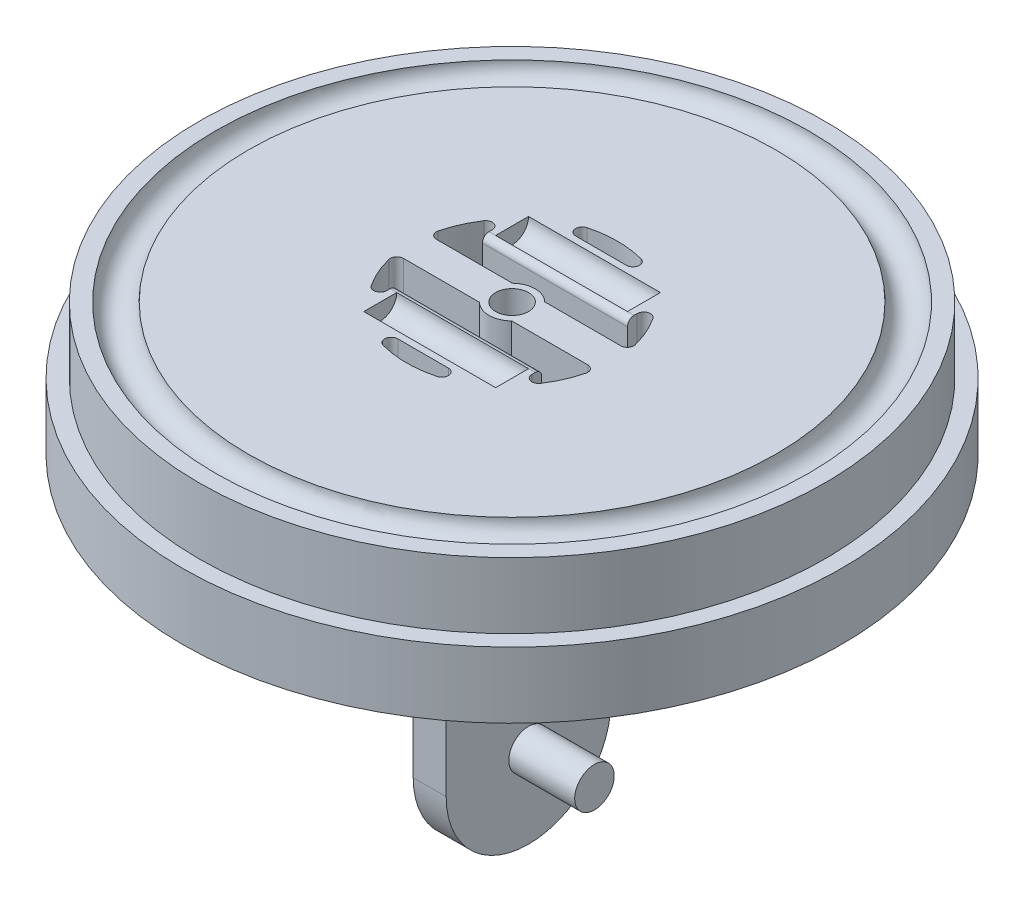
from build123d import *

# Parameters (mm, degrees)
SKETCH1_R           = 50
BOSS_EXTRUDE1_DEPTH = 10
SKETCH3_R           = 47.5
BOSS_EXTRUDE2_DEPTH = 10
SKETCH5_R           = 2.5
SKETCH6_R           = 2.5
CUT_EXTRUDE1_DEPTH  = 5
CUT_EXTRUDE2_START  = -0.01
SKETCH7_R           = 47.5
CUT_EXTRUDE2_DEPTH  = 0.01
SKETCH10_R          = 2.5
CUT_EXTRUDE4_DEPTH  = 10
CUT_EXTRUDE7_DEPTH  = 74.481971258
FILLET1_R           = 1
FILLET2_R           = 1
BOSS_EXTRUDE3_DEPTH = 2.5
FILLET3_R           = 1
FILLET4_START       = -12
FILLET4_DEPTH       = 24
FILLET5_R           = 1
SKETCH14_R          = 3
BOSS_EXTRUDE5_DEPTH = 10


with BuildPart() as part:
    # Sketch1 → Boss-Extrude1 (new body)
    with BuildSketch(Plane(origin=(0, 0, 0), x_dir=(1, 0, 0), z_dir=(0, 1, 0))):
        with Locations(Location((0, 0, 0), (0, 0, 270))):
            Circle(SKETCH1_R)
    extrude(amount=BOSS_EXTRUDE1_DEPTH)

    # Sketch3 → Boss-Extrude2 (add)
    with BuildSketch(Plane(origin=(0, 10, 0), x_dir=(1, 0, 0), z_dir=(0, 1, 0))):
        with Locations(Location((0, 0, 0), (0, 0, 270))):
            Circle(SKETCH3_R)
    extrude(amount=BOSS_EXTRUDE2_DEPTH)

    # Cut-Sweep1: sweep along a path in Sketch4
    with BuildLine(Plane(origin=(0, 20, 0), x_dir=(1, 0, 0), z_dir=(0, 1, 0))) as cut_sweep1_path:
        CenterArc((0, 0), 42.5, 0, 360)
    # Sketch5 → Cut-Sweep1 (sweep, cut)
    with BuildSketch(Plane.XY):
        with Locations((42.5, 20)):
            Circle(SKETCH5_R)
    sweep(path=cut_sweep1_path.line, mode=Mode.SUBTRACT)

    # Sketch6 → Cut-Extrude1 (cut)
    with BuildSketch(Plane(origin=(0, 20, 0), x_dir=(1, 0, 0), z_dir=(0, 1, 0))):
        with Locations(Location((0, 0, 0), (0, 0, 270))):
            Circle(SKETCH6_R)
    extrude(amount=-CUT_EXTRUDE1_DEPTH, mode=Mode.SUBTRACT)

    # Sketch7 → Cut-Extrude2 (cut)
    with BuildSketch(Plane(origin=(0, 20, 0), x_dir=(1, 0, 0), z_dir=(0, 1, 0)).offset(CUT_EXTRUDE2_START)):
        with Locations(Location((0, 0, 0), (0, 0, 270))):
            Circle(SKETCH7_R)
    extrude(amount=CUT_EXTRUDE2_DEPTH, mode=Mode.SUBTRACT)

    # Sketch10 → Cut-Extrude4 (cut, symmetric)
    with BuildSketch(Plane(origin=(0, 0, 0), x_dir=(0, 0, -1), z_dir=(1, 0, 0))):
        with Locations((-10, 19.99)):
            Circle(SKETCH10_R)
        with Locations((10, 19.99)):
            Circle(SKETCH10_R)
    extrude(amount=CUT_EXTRUDE4_DEPTH, both=True, mode=Mode.SUBTRACT)

    # Sketch11 → Cut-Extrude7 (cut, through all)
    with BuildSketch(Plane(origin=(0, 19.99, 0), x_dir=(1, 0, 0), z_dir=(0, 1, 0))):
        with BuildLine():
            ThreePointArc((-2.449489743, 2.5), (0, 3.5), (2.449489743, 2.5))
            Line((2.449489743, 2.5), (15.209986881, 2.5))
            ThreePointArc((15.209986881, 2.5), (13.746070636, 6.974184039), (11, 10.797856312))
            Line((11, 10.797856312), (11, 6.5))
            Line((11, 6.5), (-11, 6.5))
            Line((-11, 6.5), (-11, 10.797856312))
            ThreePointArc((-11, 10.797856312), (-13.746070636, 6.974184039), (-15.209986881, 2.5))
            Line((-15.209986881, 2.5), (-2.449489743, 2.5))
        make_face()
        with BuildLine():
            ThreePointArc((11, -10.797856312), (13.746070636, -6.974184039), (15.209986881, -2.5))
            Line((15.209986881, -2.5), (2.449489743, -2.5))
            ThreePointArc((2.449489743, -2.5), (0, -3.5), (-2.449489743, -2.5))
            Line((-2.449489743, -2.5), (-15.209986881, -2.5))
            ThreePointArc((-15.209986881, -2.5), (-13.746070636, -6.974184039), (-11, -10.797856312))
            Line((-11, -10.797856312), (-11, -6.5))
            Line((-11, -6.5), (11, -6.5))
            Line((11, -6.5), (11, -10.797856312))
        make_face()
        with BuildLine():
            ThreePointArc((-8.587782019, -13.5), (0, -16), (8.587782019, -13.5))
            Line((8.587782019, -13.5), (-8.587782019, -13.5))
        make_face()
        with BuildLine():
            Line((-8.587782019, 13.5), (8.587782019, 13.5))
            ThreePointArc((8.587782019, 13.5), (0, 16), (-8.587782019, 13.5))
        make_face()
    extrude(amount=-CUT_EXTRUDE7_DEPTH, mode=Mode.SUBTRACT)

    # Fillet1
    fillet1_edges = [part.edges().sort_by_distance(p)[0] for p in [
        (11, 9.995, 10.797856312),
        (-11, 9.995, 10.797856312),
        (-15.209986881, 9.995, 2.5),
        (15.209986881, 9.995, 2.5),
        (15.209986881, 9.995, -2.5),
        (-15.209986881, 9.995, -2.5),
        (-11, 9.995, -10.797856312),
        (11, 9.995, -10.797856312),
    ]]
    fillet(fillet1_edges, radius=FILLET1_R)

    # Fillet2
    fillet2_edges = [part.edges().sort_by_distance(p)[0] for p in [
        (-8.587782019, 9.995, -13.5),
        (8.587782019, 9.995, -13.5),
        (8.587782019, 9.995, 13.5),
        (-8.587782019, 9.995, 13.5),
    ]]
    fillet(fillet2_edges, radius=FILLET2_R)

    # Sketch13 → Boss-Extrude3 (add, symmetric)
    with BuildSketch(Plane(origin=(0, 0, 0), x_dir=(0, 0, -1), z_dir=(1, 0, 0))):
        with BuildLine():
            Line((-12.5, 0), (12.5, 0))
            Line((12.5, 0), (12.5, -37.5))
            ThreePointArc((12.5, -37.5), (0, -50), (-12.5, -37.5))
            Line((-12.5, -37.5), (-12.5, 0))
        make_face()
    extrude(amount=BOSS_EXTRUDE3_DEPTH, both=True)

    # Fillet3
    fillet3_edges = [part.edges().sort_by_distance(p)[0] for p in [
        (0, 0, -12.5),
        (0, 0, 12.5),
    ]]
    fillet(fillet3_edges, radius=FILLET3_R - 0.0001)  # a hair under: the kernel refuses the full size

    # Fillet4: read off the stored shape, not the designer's step
    # Fillet4 outline → Fillet4 (cut)
    with BuildSketch(Plane.YZ.offset(FILLET4_START)):
        with BuildLine():
            ThreePointArc((18.99, -6.5), (19.697106781, -6.792893219), (19.99, -7.5))
            Line((19.99, -7.5), (19.99, -6.5))
            Line((19.99, -6.5), (18.99, -6.5))
        make_face()
    extrude(amount=FILLET4_DEPTH, mode=Mode.SUBTRACT)

    # Fillet5
    fillet5_edges = [part.edges().sort_by_distance(p)[0] for p in [
        (0, 19.99, 6.5),
    ]]
    fillet(fillet5_edges, radius=FILLET5_R - 0.0001)  # a hair under: the kernel refuses the full size

    # Sketch14 → Boss-Extrude5 (add)
    with BuildSketch(Plane(origin=(2.5, 0, 0), x_dir=(0, 0, -1), z_dir=(1, 0, 0))):
        with Locations((0, -37.5)):
            Circle(SKETCH14_R)
    boss_extrude5 = extrude(amount=BOSS_EXTRUDE5_DEPTH)

    # Mirror2: Boss-Extrude5 across plane
    add(boss_extrude5.mirror(Plane(origin=(0, 0, 0), x_dir=(0, 0, 1), z_dir=(1, 0, 0))))


solid = part.part
